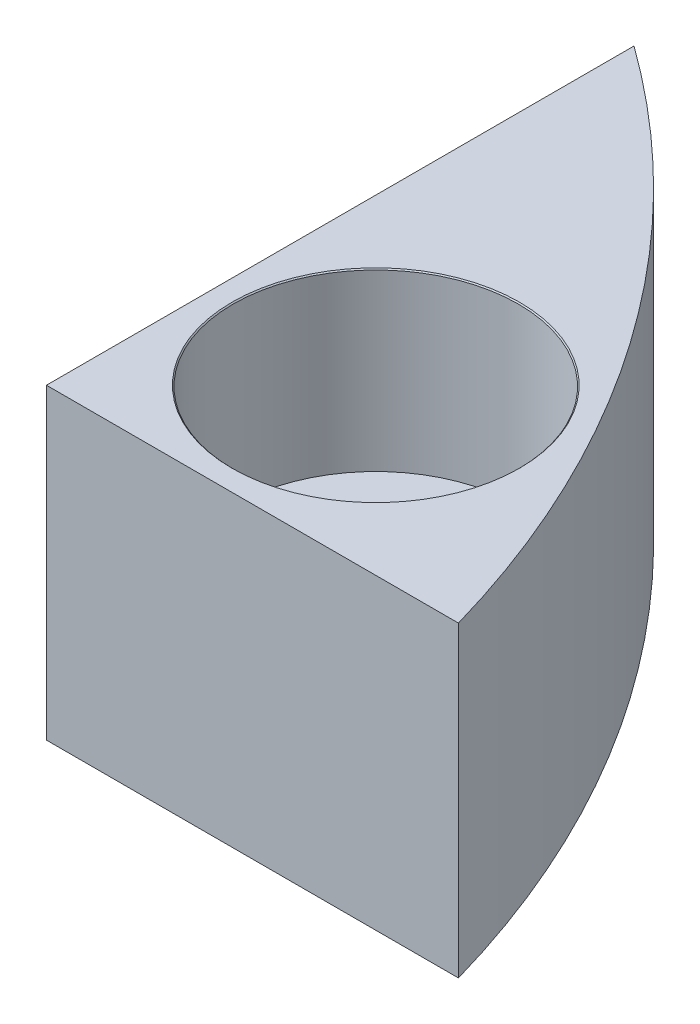
from build123d import *

# Parameters (mm, degrees)
BOSS_EXTRUDE2_DEPTH = 7


# Read off the part's stored shape, not the designer's step: CBORE for M3 SHCS1
with BuildPart() as part:
    # Sketch1 → Boss-Extrude2 (new body)
    with BuildSketch(Plane(origin=(0, 0, 0), x_dir=(1, 0, 0), z_dir=(0, 1, 0))):
        with BuildLine():
            Line((14.65303983, 6.875), (24.036105654, 6.875))
            ThreePointArc((24.036105654, 6.875), (20.468816741, 14.353659506), (14.65303983, 20.255577596))
            Line((14.65303983, 20.255577596), (14.65303983, 6.875))
        make_face()
    extrude(amount=BOSS_EXTRUDE2_DEPTH)

    # CBORE for M3 SHCS1 outline → CBORE for M3 SHCS1 (revolve, cut)
    with BuildSketch(Plane(origin=(18.40303983, 0, -10.625), x_dir=(1, 0, 0), z_dir=(0, 0, 1))):
        Polygon((0, 0), (1.6, 0), (1.6, 2.975), (1.625, 3), (3.25, 3), (3.25, 6.975), (3.275, 7), (0, 7), align=None)
    revolve(axis=Axis((18.40303983, 0, -10.625), (0, 1, 0)), mode=Mode.SUBTRACT)


solid = part.part
